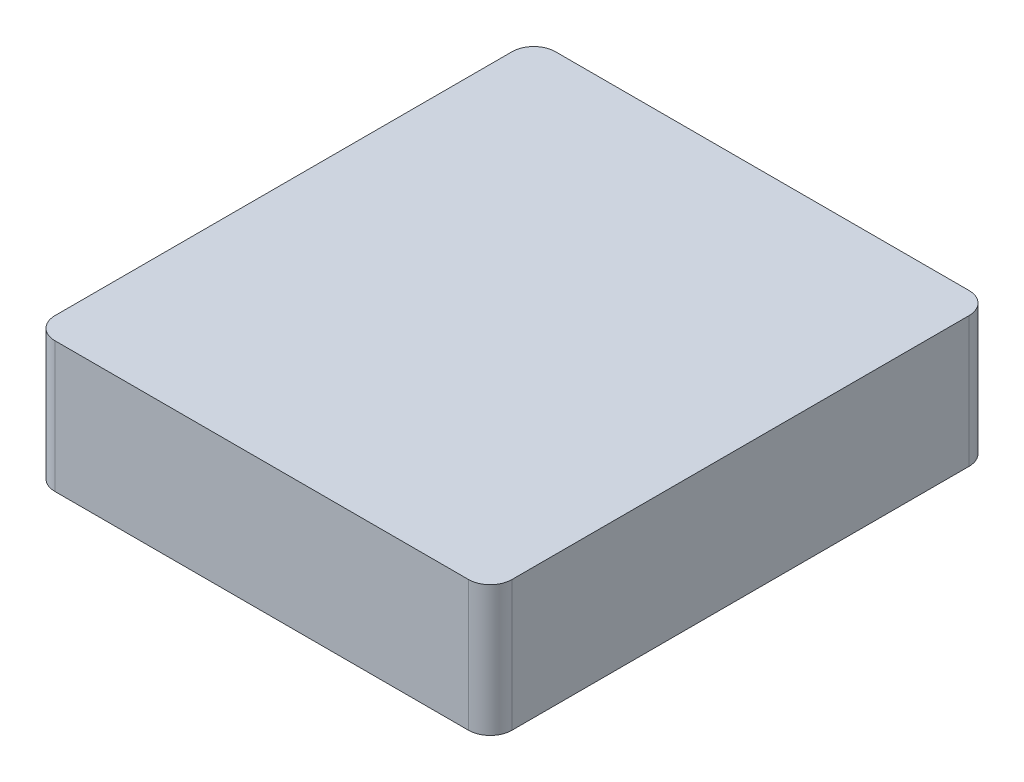
from build123d import *

# Parameters (mm, degrees)
SKETCH3_W           = 21
SKETCH3_H           = 23
BOSS_EXTRUDE2_DEPTH = 6
FILLET1_R           = 1


with BuildPart() as part:
    # Sketch3 → Boss-Extrude2 (new body)
    with BuildSketch(Plane(origin=(0, 0, 0), x_dir=(1, 0, 0), z_dir=(0, 1, 0))):
        Rectangle(SKETCH3_W, SKETCH3_H)
    extrude(amount=BOSS_EXTRUDE2_DEPTH)

    # Fillet1
    fillet1_edges = [part.edges().sort_by_distance(p)[0] for p in [
        (-10.5, 3, -11.5),
        (10.5, 3, -11.5),
        (10.5, 3, 11.5),
        (-10.5, 3, 11.5),
    ]]
    fillet(fillet1_edges, radius=FILLET1_R)


solid = part.part
